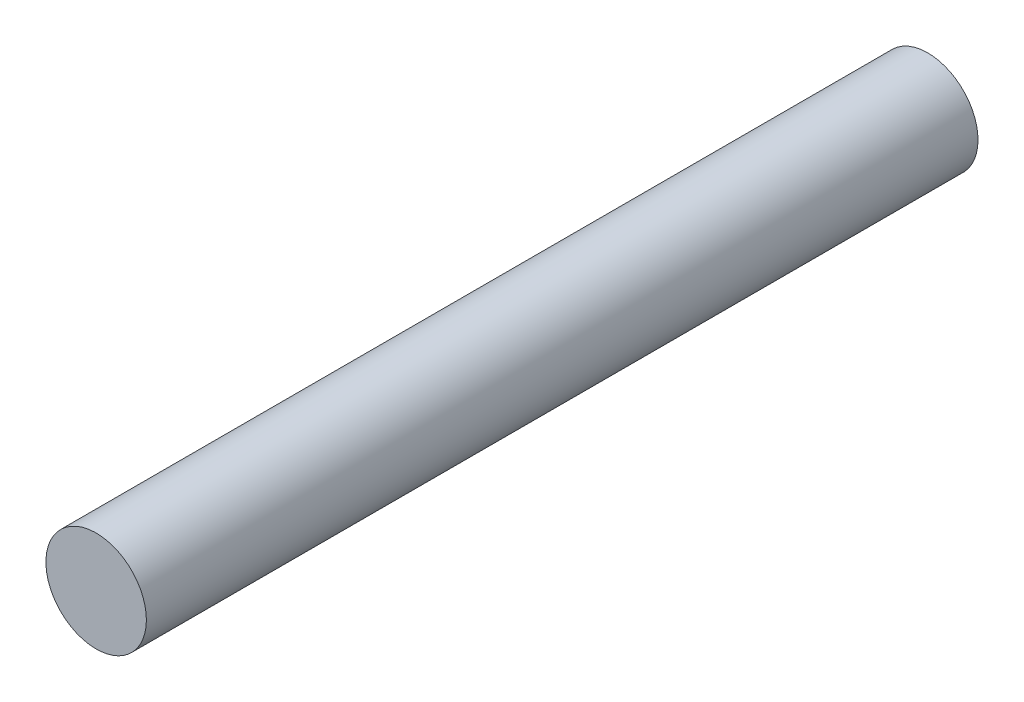
from build123d import *

# Parameters (mm, degrees)
SKETCH2_R           = 7.25
BOSS_EXTRUDE1_DEPTH = 120


with BuildPart() as part:
    # Sketch2 → Boss-Extrude1 (new body)
    with BuildSketch(Plane.XY):
        Circle(SKETCH2_R)
    extrude(amount=BOSS_EXTRUDE1_DEPTH)


solid = part.part
